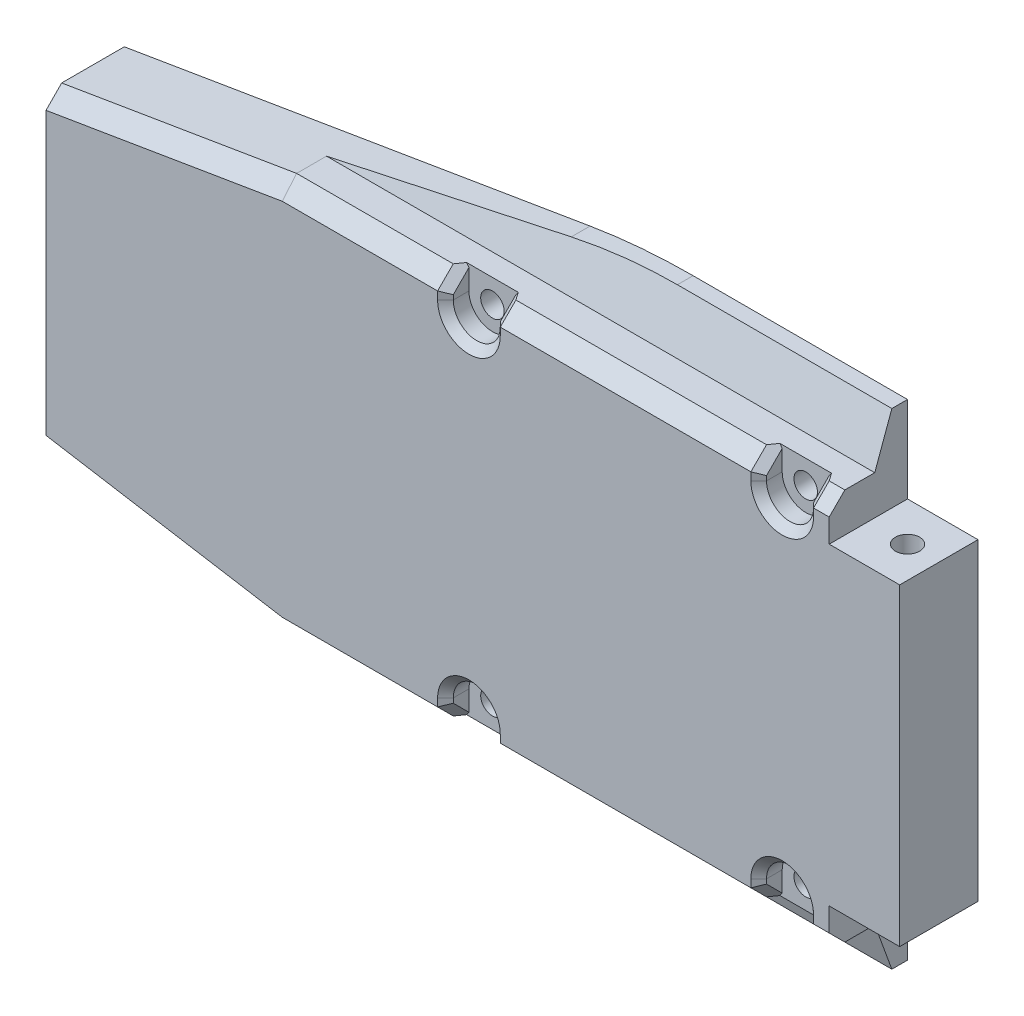
from build123d import *

# Parameters (mm, degrees)
AUFSATZ_LINEAR_AUSTRAGEN1_DEPTH      = 5
AUFSATZ_LINEAR_AUSTRAGEN1_DEPTH_BACK = 5
F_3_1_3_1_DURCHMESSER_BOHRUNG1_D     = 3.1
F_3_1_3_1_DURCHMESSER_BOHRUNG1_DEPTH = 8
F_3_1_3_1_DURCHMESSER_BOHRUNG1_TIP   = 0.931333959
SCHNITT_LINEAR_AUSTRAGEN1_DEPTH      = 112.941949242
SCHNITT_LINEAR_AUSTRAGEN1_DEPTH_BACK = 112.941949242
SKIZZE5_R                            = 1.5
SCHNITT_LINEAR_AUSTRAGEN2_DEPTH      = 3
SCHNITT_LINEAR_AUSTRAGEN3_DEPTH      = 113.276444546
SCHNITT_LINEAR_AUSTRAGEN3_DEPTH_BACK = 113.276444546
SKIZZE7_W                            = 9
SKIZZE7_H                            = 5
SCHNITT_LINEAR_AUSTRAGEN4_DEPTH      = 4
SCHNITT_LINEAR_AUSTRAGEN4_DEPTH_BACK = 112.941949242
AUFSATZ_LINEAR_AUSTRAGEN2_DEPTH      = 2
FASE1_SIZE2                          = 6
FASE1_SIZE                           = 2.183821406
FASE2_SIZE2                          = 6
FASE2_SIZE                           = 2.183821406
VERRUNDUNG1_R                        = 80
VERRUNDUNG2_R                        = 2
SKIZZE12_W                           = 10
SKIZZE12_H                           = 22
AUFSATZ_LINEAR_AUSTRAGEN3_DEPTH      = 1
FASE3_SIZE                           = 2
SCHNITT_LINEAR_AUSTRAGEN5_REACH      = 115.763
FASE4_SIZE                           = 1


# Some blends are built 0.0001 mm under size
with BuildPart() as part:
    # Skizze2 → Aufsatz-Linear austragen1 (new, two sides: drawn at the far end of the back side and taken through both)
    with BuildSketch(Plane.XY.offset(-AUFSATZ_LINEAR_AUSTRAGEN1_DEPTH_BACK)):
        with BuildLine():
            Line((0, 25), (-79, 25))
            Line((-79, 25), (-109, 20))
            Line((-109, 20), (-109, 11))
            Line((-109, 11), (-102, 11))
            ThreePointArc((-102, 11), (-99.878679656, 10.121320344), (-99, 8))
            Line((-99, 8), (-99, -8))
            ThreePointArc((-99, -8), (-99.878679656, -10.121320344), (-102, -11))
            Line((-102, -11), (-109, -11))
            Line((-109, -11), (-109, -20))
            Line((-109, -20), (-79, -25))
            Line((-79, -25), (0, -25))
            Line((0, -25), (0, 25))
        make_face()
    extrude(amount=AUFSATZ_LINEAR_AUSTRAGEN1_DEPTH + AUFSATZ_LINEAR_AUSTRAGEN1_DEPTH_BACK)

    # Ø3.1 (3.1) Durchmesser Bohrung1
    with Locations(Plane.ZY.offset(109)):
        with Locations((0, 15), (0, -15)):
            Hole(F_3_1_3_1_DURCHMESSER_BOHRUNG1_D / 2, depth=F_3_1_3_1_DURCHMESSER_BOHRUNG1_DEPTH)
            with Locations((0, 0, -(F_3_1_3_1_DURCHMESSER_BOHRUNG1_DEPTH + F_3_1_3_1_DURCHMESSER_BOHRUNG1_TIP / 2))):  # 118° drill point
                Cone(0, F_3_1_3_1_DURCHMESSER_BOHRUNG1_D / 2, F_3_1_3_1_DURCHMESSER_BOHRUNG1_TIP, mode=Mode.SUBTRACT)

    # Skizze5 → Schnitt-Linear austragen1 (cut, two sides: drawn at the far end of the back side and taken through both)
    with BuildSketch(Plane.XY.offset(-SCHNITT_LINEAR_AUSTRAGEN1_DEPTH_BACK)):
        with Locations((-55, 22)):
            Circle(SKIZZE5_R)
        with Locations((-15, 22)):
            Circle(SKIZZE5_R)
        with Locations(Location((-15, -22, 0), (0, 0, 180))):
            Circle(SKIZZE5_R)
        with Locations(Location((-55, -22, 0), (0, 0, 180))):
            Circle(SKIZZE5_R)
    extrude(amount=SCHNITT_LINEAR_AUSTRAGEN1_DEPTH + SCHNITT_LINEAR_AUSTRAGEN1_DEPTH_BACK, mode=Mode.SUBTRACT)

    # Skizze6 → Schnitt-Linear austragen2 (cut)
    with BuildSketch(Plane.XY.offset(5)):
        with BuildLine():
            Line((-58, 22), (-58, 29.262582446))
            ThreePointArc((-58, 29.262582446), (-55, 32.262582446), (-52, 29.262582446))
            Line((-52, 29.262582446), (-52, 22))
            ThreePointArc((-52, 22), (-55, 19), (-58, 22))
        make_face()
        with BuildLine():
            Line((-18, 22), (-18, 29.262582446))
            ThreePointArc((-18, 29.262582446), (-15, 32.262582446), (-12, 29.262582446))
            Line((-12, 29.262582446), (-12, 22))
            ThreePointArc((-12, 22), (-15, 19), (-18, 22))
        make_face()
        with BuildLine():
            Line((-52, -22), (-52, -29.780690507))
            ThreePointArc((-52, -29.780690507), (-55, -32.780690507), (-58, -29.780690507))
            Line((-58, -29.780690507), (-58, -22))
            ThreePointArc((-58, -22), (-55, -19), (-52, -22))
        make_face()
        with BuildLine():
            Line((-12, -22), (-12, -30.84862117))
            ThreePointArc((-12, -30.84862117), (-15, -33.84862117), (-18, -30.84862117))
            Line((-18, -30.84862117), (-18, -22))
            ThreePointArc((-18, -22), (-15, -19), (-12, -22))
        make_face()
    extrude(amount=-SCHNITT_LINEAR_AUSTRAGEN2_DEPTH, mode=Mode.SUBTRACT)

    # Skizze7 → Schnitt-Linear austragen3 (cut, two sides: drawn at the far end of the back side and taken through both)
    with BuildSketch(Plane.XY.offset(5).offset(-SCHNITT_LINEAR_AUSTRAGEN3_DEPTH_BACK)):
        with Locations((-4.5, 22.5)):
            Rectangle(SKIZZE7_W, SKIZZE7_H)
        with Locations((-4.5, -22.5)):
            Rectangle(SKIZZE7_W, SKIZZE7_H)
    extrude(amount=SCHNITT_LINEAR_AUSTRAGEN3_DEPTH + SCHNITT_LINEAR_AUSTRAGEN3_DEPTH_BACK, mode=Mode.SUBTRACT)

    # Skizze8 → Schnitt-Linear austragen4 (cut, two sides: drawn at the far end of the back side and taken through both)
    with BuildSketch(Plane.XY.offset(-SCHNITT_LINEAR_AUSTRAGEN4_DEPTH_BACK)):
        with BuildLine():
            Line((-51, -22), (-19, -22))
            ThreePointArc((-19, -22), (-17.828427125, -19.171572875), (-15, -18))
            Line((-15, -18), (-7, -18))
            Line((-7, -18), (-7, 18))
            Line((-7, 18), (-15, 18))
            ThreePointArc((-15, 18), (-17.828427125, 19.171572875), (-19, 22))
            Line((-19, 22), (-51, 22))
            ThreePointArc((-51, 22), (-51.83772234, 19.550510257), (-54, 18.127016654))
            Line((-54, 18.127016654), (-54, -18.127016654))
            ThreePointArc((-54, -18.127016654), (-51.83772234, -19.550510257), (-51, -22))
        make_face()
        with BuildLine():
            Line((-56, 18.127016654), (-56, -18.127016654))
            ThreePointArc((-56, -18.127016654), (-58.16227766, -19.550510257), (-59, -22))
            Line((-59, -22), (-78.751712409, -22))
            Line((-78.751712409, -22), (-97, -18.958618735))
            Line((-97, -18.958618735), (-97, 18.958618735))
            Line((-97, 18.958618735), (-78.751712409, 22))
            Line((-78.751712409, 22), (-59, 22))
            ThreePointArc((-59, 22), (-58.16227766, 19.550510257), (-56, 18.127016654))
        make_face()
    extrude(amount=SCHNITT_LINEAR_AUSTRAGEN4_DEPTH + SCHNITT_LINEAR_AUSTRAGEN4_DEPTH_BACK, mode=Mode.SUBTRACT)

    # Skizze9 → Aufsatz-Linear austragen2 (add)
    with BuildSketch(Plane(origin=(0, 0, -5), x_dir=(-1, 0, 0), z_dir=(0, 0, -1))):
        Polygon((9, 25), (9, 31), (43, 31), (79, 25), align=None)
        Polygon((9, -25), (79, -25), (43, -31), (9, -31), align=None)
    extrude(amount=-AUFSATZ_LINEAR_AUSTRAGEN2_DEPTH)

    # Skizze10 → Ø3.1 (3.1) Durchmesser Bohrung2 (revolve, cut)
    with BuildSketch(Plane(origin=(-4, 20, 0), x_dir=(0, 0, 1), z_dir=(1, 0, 0))):
        Polygon((0, 0), (0, 10.931333959), (1.55, 10), (1.55, 0), align=None)
    f_3_1_3_1_durchmesser_bohrung2 = revolve(axis=Axis((-4, 26.35, 0), (0, -1, 0)), mode=Mode.SUBTRACT)

    # Spiegeln1: Ø3.1 (3.1) Durchmesser Bohrung2 across plane
    add(f_3_1_3_1_durchmesser_bohrung2.mirror(Plane.ZX), mode=Mode.SUBTRACT)

    # Fase1
    fase1_edges = [part.edges().sort_by_distance(p)[0] for p in [
        (-44, 25, -3),
    ]]
    fase1_side = [part.faces().sort_by_distance(p)[0] for p in [
        (-44, 25, -2.956323572),
    ]]
    chamfer(fase1_edges, length=FASE1_SIZE - 0.0001, length2=FASE1_SIZE2 - 0.0001, reference=fase1_side[0])  # a hair under: the kernel refuses the full size

    # Fase2
    fase2_edges = [part.edges().sort_by_distance(p)[0] for p in [
        (-44, -25, -3),
    ]]
    fase2_side = [part.faces().sort_by_distance(p)[0] for p in [
        (-44, -25, -2.956323572),
    ]]
    chamfer(fase2_edges, length=FASE2_SIZE - 0.0001, length2=FASE2_SIZE2 - 0.0001, reference=fase2_side[0])  # a hair under: the kernel refuses the full size

    # Verrundung1
    verrundung1_edges = [part.edges().sort_by_distance(p)[0] for p in [
        (-43, 31, -4),
        (-43, -31, -4),
    ]]
    fillet(verrundung1_edges, radius=VERRUNDUNG1_R)

    # Verrundung2
    verrundung2_edges = [part.edges().sort_by_distance(p)[0] for p in [
        (-19, 22, -0.5),
        (-51, 22, -0.5),
        (-54, 18.127016654, -0.5),
        (-54, -18.127016654, -0.5),
        (-51, -22, -0.5),
        (-19, -22, -0.5),
        (-7, -18, -0.5),
        (-7, 18, -0.5),
        (-59, -22, -0.5),
        (-56, -18.127016654, -0.5),
        (-56, 18.127016654, -0.5),
        (-59, 22, -0.5),
        (-97, 18.958618735, -0.5),
        (-97, -18.958618735, -0.5),
    ]]
    fillet(verrundung2_edges, radius=VERRUNDUNG2_R)

    # Skizze12 → Aufsatz-Linear austragen3 (add)
    with BuildSketch(Plane.XY.offset(5)):
        with Locations((-104, 0)):
            Rectangle(SKIZZE12_W, SKIZZE12_H)
    extrude(amount=-AUFSATZ_LINEAR_AUSTRAGEN3_DEPTH)

    # Fase3
    fase3_edges = [part.edges().sort_by_distance(p)[0] for p in [
        (-10.5, 25, 5),
        (-94, 22.5, 5),
        (-94, -22.5, 5),
        (-68.5, -25, 5),
        (-35, 25, 5),
        (-68.5, 25, 5),
        (-35, -25, 5),
        (-10.5, -25, 5),
    ]]
    chamfer(fase3_edges, length=FASE3_SIZE)

    # Schnitt-Linear austragen5: up to this face of the body (flat: up to its plane)
    schnitt_linear_austragen5_end = Plane(part.part.faces().sort_by_distance((-31.128414166, 0, 4))[0])
    # Skizze13 → Schnitt-Linear austragen5 (cut, up to the picked face)
    with BuildSketch(Plane(origin=(0, 0, -5), x_dir=(-1, 0, 0), z_dir=(0, 0, -1)), mode=Mode.PRIVATE) as schnitt_linear_austragen5_sk1:
        with BuildLine():
            Line((5.5, 10), (5.5, -10))
            ThreePointArc((5.5, -10), (4, -11.5), (2.5, -10))
            Line((2.5, -10), (2.5, 10))
            ThreePointArc((2.5, 10), (4, 11.5), (5.5, 10))
        make_face()
    schnitt_linear_austragen5_tool1 = split(extrude(schnitt_linear_austragen5_sk1.sketch, amount=-SCHNITT_LINEAR_AUSTRAGEN5_REACH, mode=Mode.PRIVATE), bisect_by=schnitt_linear_austragen5_end, keep=Keep.BOTH, mode=Mode.PRIVATE)
    add(schnitt_linear_austragen5_tool1.solids().sort_by(Axis((-4, 0, -5), (0, 0, 1)))[0], mode=Mode.SUBTRACT)

    # Fase4
    # the kernel refuses this chamfer: 1 mm, written as the material it takes off along each edge
    with BuildSketch(Plane(origin=(-12, -21.18154552, 6.81845448), x_dir=(0.9996219169112968, -0.01944252080601251, 0.01944252080601251), z_dir=(0, -0.7071067811865476, -0.7071067811865476))) as fase4_piece_1_section:
        Polygon((FASE4_SIZE * 0.999621916911, -FASE4_SIZE * 0.0274958766106), (-FASE4_SIZE * 0.0274958766106, -FASE4_SIZE * 0.999621916911), (0, 0), align=None)
    fase4_piece_1 = extrude(amount=7.971793101, mode=Mode.PRIVATE)
    fase4_piece_1 = split(fase4_piece_1, bisect_by=Plane(origin=(-11.681385886, -23.736257989, 2), z_dir=(0, 0, 1)), keep=Keep.TOP, mode=Mode.PRIVATE)
    add(fase4_piece_1, mode=Mode.SUBTRACT)
    with BuildSketch(Plane(origin=(-18, -21.18154552, 6.81845448), x_dir=(0.027495876610585647, 0.7068394360706736, -0.7068394360706736), z_dir=(0, -0.7071067811865476, -0.7071067811865476))) as fase4_piece_2_section:
        Polygon((FASE4_SIZE * 0.999621916911, -FASE4_SIZE * 0.0274958766106), (-FASE4_SIZE * 0.0274958766106, -FASE4_SIZE * 0.999621916911), (0, 0), align=None)
    fase4_piece_2 = extrude(amount=7.971793101, mode=Mode.PRIVATE)
    fase4_piece_2 = split(fase4_piece_2, bisect_by=Plane(origin=(-18.318614114, -23.736257989, 2), z_dir=(0, 0, 1)), keep=Keep.TOP, mode=Mode.PRIVATE)
    add(fase4_piece_2, mode=Mode.SUBTRACT)
    with BuildSketch(Plane(origin=(-12, -22, 5), x_dir=(0.9996219169112968, 0, 0.027495876610586414), z_dir=(0, -1, 0)), Plane(origin=(-18, -25.571682988, 5), x_dir=(-0.9996219169112968, 0, 0.02749587661058651), z_dir=(0, 1, 0)), Plane(origin=(-58, 22, 5), x_dir=(-0.9996219169112968, 0, 0.027495876610586414), z_dir=(0, 1, 0)), Plane(origin=(-52, 25.571682988, 5), x_dir=(0.9996219169112968, 0, 0.027495876610586414), z_dir=(0, -1, 0)), Plane(origin=(-12, 25.571682988, 5), x_dir=(0.9996219169112968, 0, 0.02749587661058651), z_dir=(0, -1, 0)), Plane(origin=(-52, -22, 5), x_dir=(0.9996219169112968, 0, 0.027495876610586414), z_dir=(0, -1, 0)), Plane(origin=(-58, -25.571682988, 5), x_dir=(-0.9996219169112968, 0, 0.027495876610586414), z_dir=(0, 1, 0))) as fase4_piece_3:
        Polygon((FASE4_SIZE * 0.999621916911, -FASE4_SIZE * 0.0274958766106), (-FASE4_SIZE * 0.0274958766106, -FASE4_SIZE * 0.999621916911), (0, 0), align=None)
    extrude(amount=3.571682988, mode=Mode.SUBTRACT)
    with BuildSketch(Plane(origin=(-15, -22, 5), x_dir=(-1, 0, 0), z_dir=(0, -1, 0))) as fase4_piece_4:
        Polygon((3 + FASE4_SIZE, 0), (3, FASE4_SIZE), (3, 0), align=None)
    revolve(axis=Axis((-15, -22, 5), (0, 0, -1)), revolution_arc=180, mode=Mode.SUBTRACT)
    with BuildSketch(Plane(origin=(-58, 21.18154552, 6.81845448), x_dir=(0.027495876610589096, -0.7068394360706733, -0.7068394360706733), z_dir=(0, 0.7071067811865476, -0.7071067811865476))) as fase4_piece_5_section:
        Polygon((FASE4_SIZE * 0.999621916911, FASE4_SIZE * 0.0274958766106), (-FASE4_SIZE * 0.0274958766106, FASE4_SIZE * 0.999621916911), (0, 0), align=None)
    fase4_piece_5 = extrude(amount=7.971793101, mode=Mode.PRIVATE)
    fase4_piece_5 = split(fase4_piece_5, bisect_by=Plane(origin=(-58.318614114, 23.736257989, 2), z_dir=(0, 0, 1)), keep=Keep.TOP, mode=Mode.PRIVATE)
    add(fase4_piece_5, mode=Mode.SUBTRACT)
    with BuildSketch(Plane(origin=(-52, 21.18154552, 6.81845448), x_dir=(0.9996219169112965, 0.019442520806015894, 0.019442520806015894), z_dir=(0, 0.7071067811865476, -0.7071067811865476))) as fase4_piece_6_section:
        Polygon((FASE4_SIZE * 0.999621916911, FASE4_SIZE * 0.0274958766106), (-FASE4_SIZE * 0.0274958766106, FASE4_SIZE * 0.999621916911), (0, 0), align=None)
    fase4_piece_6 = extrude(amount=7.971793101, mode=Mode.PRIVATE)
    fase4_piece_6 = split(fase4_piece_6, bisect_by=Plane(origin=(-51.681385886, 23.736257989, 2), z_dir=(0, 0, 1)), keep=Keep.TOP, mode=Mode.PRIVATE)
    add(fase4_piece_6, mode=Mode.SUBTRACT)
    with BuildSketch(Plane(origin=(-55, 22, 5), x_dir=(1, 0, 0), z_dir=(0, 1, 0))) as fase4_piece_7:
        Polygon((3 + FASE4_SIZE, 0), (3, FASE4_SIZE), (3, 0), align=None)
    revolve(axis=Axis((-55, 22, 5), (0, 0, -1)), revolution_arc=180, mode=Mode.SUBTRACT)
    with BuildSketch(Plane(origin=(-18, 21.18154552, 6.81845448), x_dir=(0.027495876610585664, -0.7068394360706736, -0.7068394360706736), z_dir=(0, 0.7071067811865476, -0.7071067811865476))) as fase4_piece_8_section:
        Polygon((FASE4_SIZE * 0.999621916911, FASE4_SIZE * 0.0274958766106), (-FASE4_SIZE * 0.0274958766106, FASE4_SIZE * 0.999621916911), (0, 0), align=None)
    fase4_piece_8 = extrude(amount=7.971793101, mode=Mode.PRIVATE)
    fase4_piece_8 = split(fase4_piece_8, bisect_by=Plane(origin=(-18.318614114, 23.736257989, 2), z_dir=(0, 0, 1)), keep=Keep.TOP, mode=Mode.PRIVATE)
    add(fase4_piece_8, mode=Mode.SUBTRACT)
    with BuildSketch(Plane(origin=(-12, 21.18154552, 6.81845448), x_dir=(0.9996219169112968, 0.019442520806014274, 0.019442520806014274), z_dir=(0, 0.7071067811865476, -0.7071067811865476))) as fase4_piece_9_section:
        Polygon((FASE4_SIZE * 0.999621916911, FASE4_SIZE * 0.0274958766106), (-FASE4_SIZE * 0.0274958766106, FASE4_SIZE * 0.999621916911), (0, 0), align=None)
    fase4_piece_9 = extrude(amount=7.971793101, mode=Mode.PRIVATE)
    fase4_piece_9 = split(fase4_piece_9, bisect_by=Plane(origin=(-11.681385886, 23.736257989, 2), z_dir=(0, 0, 1)), keep=Keep.TOP, mode=Mode.PRIVATE)
    add(fase4_piece_9, mode=Mode.SUBTRACT)
    with BuildSketch(Plane(origin=(-18, 22, 5), x_dir=(0.027495876610585623, 0, -0.9996219169112968), z_dir=(0, 1, 0))) as fase4_piece_10:
        Polygon((FASE4_SIZE * 0.999621916911, FASE4_SIZE * 0.0274958766106), (-FASE4_SIZE * 0.0274958766106, FASE4_SIZE * 0.999621916911), (0, 0), align=None)
    extrude(amount=3.571682988, mode=Mode.SUBTRACT)
    with BuildSketch(Plane(origin=(-15, 22, 5), x_dir=(1, 0, 0), z_dir=(0, 1, 0))) as fase4_piece_11:
        Polygon((3 + FASE4_SIZE, 0), (3, FASE4_SIZE), (3, 0), align=None)
    revolve(axis=Axis((-15, 22, 5), (0, 0, -1)), revolution_arc=180, mode=Mode.SUBTRACT)
    with BuildSketch(Plane(origin=(-55, -22, 5), x_dir=(-1, 0, 0), z_dir=(0, -1, 0))) as fase4_piece_12:
        Polygon((3 + FASE4_SIZE, 0), (3, FASE4_SIZE), (3, 0), align=None)
    revolve(axis=Axis((-55, -22, 5), (0, 0, -1)), revolution_arc=180, mode=Mode.SUBTRACT)
    with BuildSketch(Plane(origin=(-58, -21.18154552, 6.81845448), x_dir=(0.027495876610589096, 0.7068394360706733, -0.7068394360706733), z_dir=(0, -0.7071067811865476, -0.7071067811865476))) as fase4_piece_13_section:
        Polygon((FASE4_SIZE * 0.999621916911, -FASE4_SIZE * 0.0274958766106), (-FASE4_SIZE * 0.0274958766106, -FASE4_SIZE * 0.999621916911), (0, 0), align=None)
    fase4_piece_13 = extrude(amount=7.971793101, mode=Mode.PRIVATE)
    fase4_piece_13 = split(fase4_piece_13, bisect_by=Plane(origin=(-58.318614114, -23.736257989, 2), z_dir=(0, 0, 1)), keep=Keep.TOP, mode=Mode.PRIVATE)
    add(fase4_piece_13, mode=Mode.SUBTRACT)
    with BuildSketch(Plane(origin=(-52, -21.18154552, 6.81845448), x_dir=(0.9996219169112968, -0.01944252080601374, 0.01944252080601374), z_dir=(0, -0.7071067811865476, -0.7071067811865476))) as fase4_piece_14_section:
        Polygon((FASE4_SIZE * 0.999621916911, -FASE4_SIZE * 0.0274958766106), (-FASE4_SIZE * 0.0274958766106, -FASE4_SIZE * 0.999621916911), (0, 0), align=None)
    fase4_piece_14 = extrude(amount=7.971793101, mode=Mode.PRIVATE)
    fase4_piece_14 = split(fase4_piece_14, bisect_by=Plane(origin=(-51.681385886, -23.736257989, 2), z_dir=(0, 0, 1)), keep=Keep.TOP, mode=Mode.PRIVATE)
    add(fase4_piece_14, mode=Mode.SUBTRACT)


solid = part.part
